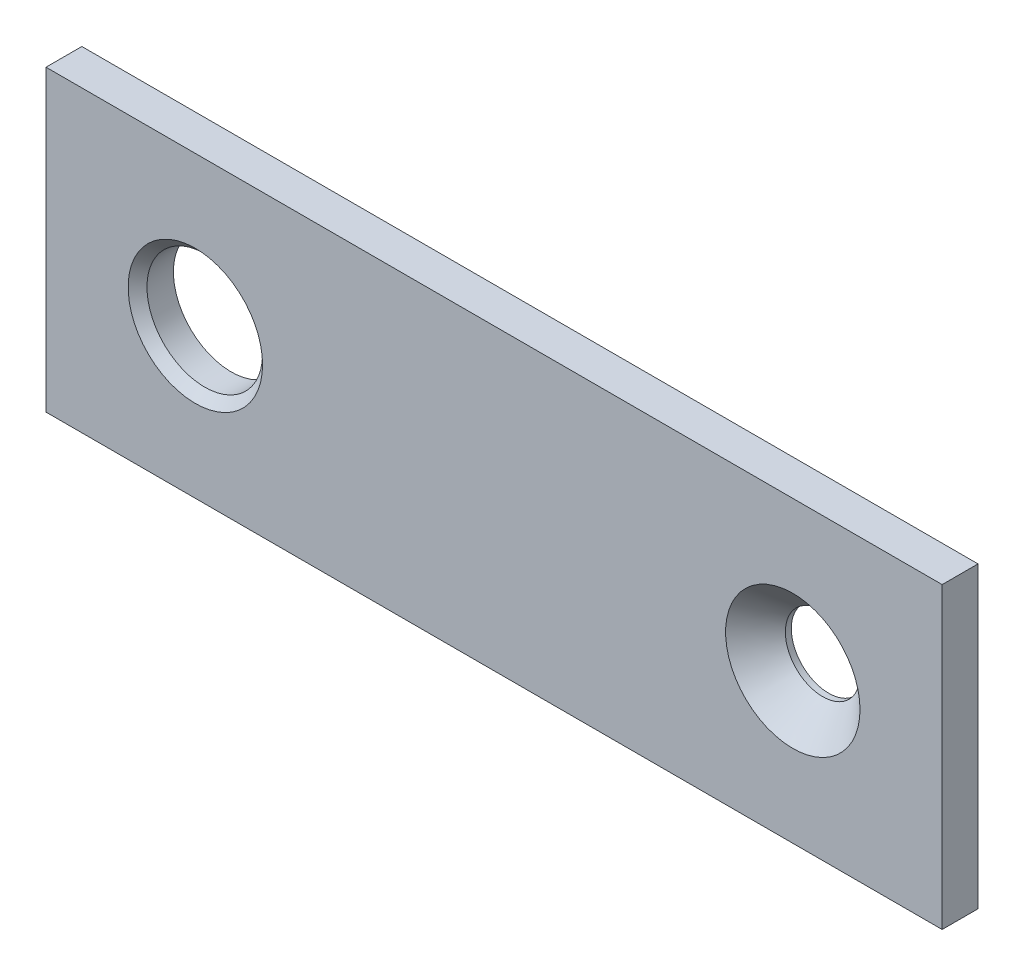
from build123d import *

# Parameters (mm, degrees)
SKETCH1_W                    = 38.1
SKETCH1_H                    = 12.7
BOSS_EXTRUDE1_DEPTH          = 1.524
SKETCH2_R                    = 1.5875
CUT_EXTRUDE1_DEPTH           = 21.138211837
CHAMFER1_SIZE                = 1.27
F_10_0_1935_DIAMETER_HOLE1_D = 4.9149


# Read off the part's stored shape, not the designer's step: deleteface
with BuildPart() as part:
    # Sketch1 → Boss-Extrude1 (new body)
    with BuildSketch(Plane.XY):
        Rectangle(SKETCH1_W, SKETCH1_H)
    extrude(amount=-BOSS_EXTRUDE1_DEPTH)

    # Sketch2 → Cut-Extrude1 (cut, through all)
    with BuildSketch(Plane.XY):
        with Locations((-12.7, 0)):
            Circle(SKETCH2_R)
        with Locations((-4.233333333, 0)):
            Circle(SKETCH2_R)
        with Locations((4.233333333, 0)):
            Circle(SKETCH2_R)
        with Locations((12.7, 0)):
            Circle(SKETCH2_R)
    extrude(amount=-CUT_EXTRUDE1_DEPTH, mode=Mode.SUBTRACT)

    # Chamfer1
    chamfer1_edges = [part.edges().sort_by_distance(p)[0] for p in [
        (-14.2875, 0, 0),
        (-5.820833333, 0, 0),
        (2.645833333, 0, 0),
        (11.1125, 0, 0),
    ]]
    chamfer(chamfer1_edges, length=CHAMFER1_SIZE)

    # deleteface outline → deleteface (revolve)
    with BuildSketch(Plane(origin=(-4.233333333, 0, 0), x_dir=(1, 0, 0), z_dir=(0, -1, 0))):
        Polygon((0, -1.524), (1.5875, -1.524), (1.5875, -1.27), (2.8575, 0), (0, 0), align=None)
    revolve(axis=Axis((-4.233333333, 0, 0), (0, 0, 1)))

    # deleteface 2 outline → deleteface 2 (revolve)
    with BuildSketch(Plane(origin=(4.233333333, 0, 0), x_dir=(1, 0, 0), z_dir=(0, -1, 0))):
        Polygon((0, -1.524), (1.5875, -1.524), (1.5875, -1.27), (2.8575, 0), (0, 0), align=None)
    revolve(axis=Axis((4.233333333, 0, 0), (0, 0, 1)))

    # #10 (0.1935) Diameter Hole1 (through all)
    with Locations(Plane.XY):
        with Locations((-12.7, 0)):
            Hole(F_10_0_1935_DIAMETER_HOLE1_D / 2)


solid = part.part
